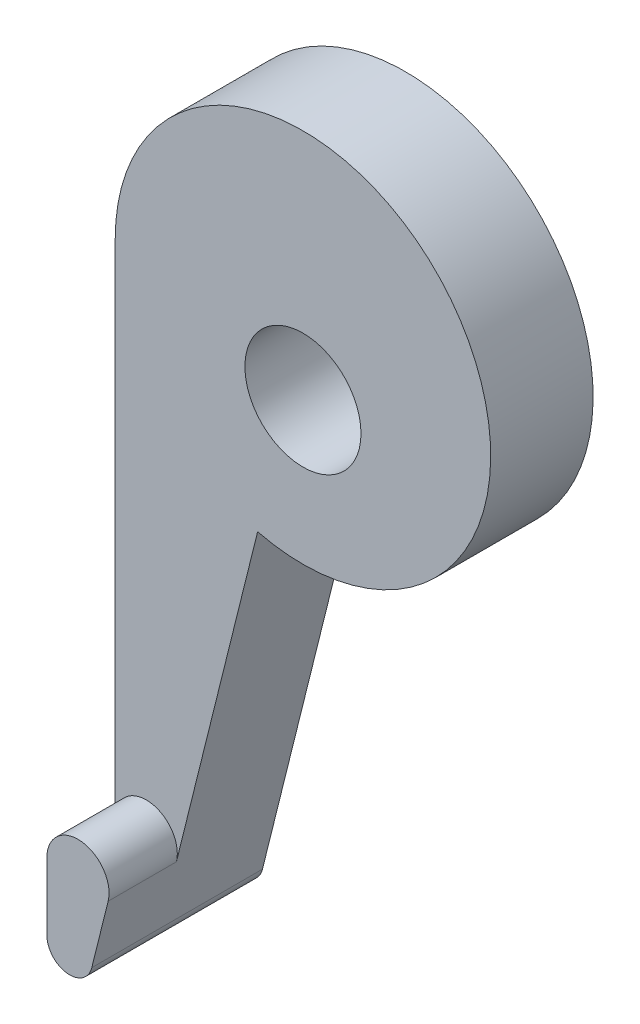
from build123d import *

# Parameters (mm, degrees)
SKETCH1_R           = 2.55
BOSS_EXTRUDE1_DEPTH = 4.5
BOSS_EXTRUDE2_DEPTH = 3


with BuildPart() as part:
    # Sketch1 → Boss-Extrude1 (new body)
    with BuildSketch(Plane.XY):
        with BuildLine():
            Line((1.335499014, 8.518725494), (1.335499014, -16.481274506))
            ThreePointArc((1.335499014, -16.481274506), (2.213885401, -17.473852024), (3.305919272, -16.722696381))
            Line((3.305919272, -16.722696381), (7.593768545, 0.512758361))
            ThreePointArc((7.593768545, 0.512758361), (16.08527887, 13.599607486), (1.335499014, 8.518725494))
        make_face()
        with Locations((9.585499014, 6.518725494)):
            Circle(SKETCH1_R, mode=Mode.SUBTRACT)
    extrude(amount=BOSS_EXTRUDE1_DEPTH)

    # Sketch2 → Boss-Extrude2 (add)
    with BuildSketch(Plane.XY.offset(4.5)):
        with BuildLine():
            Line((1.335499014, -13.503541952), (1.335499014, -16.481274506))
            ThreePointArc((1.335499014, -16.481274506), (2.213885401, -17.473852024), (3.305919272, -16.722696381))
            Line((3.305919272, -16.722696381), (4.024809049, -13.833044386))
            ThreePointArc((4.024809049, -13.833044386), (2.866323075, -12.148831621), (1.335499014, -13.503541952))
        make_face()
    extrude(amount=BOSS_EXTRUDE2_DEPTH)


solid = part.part
